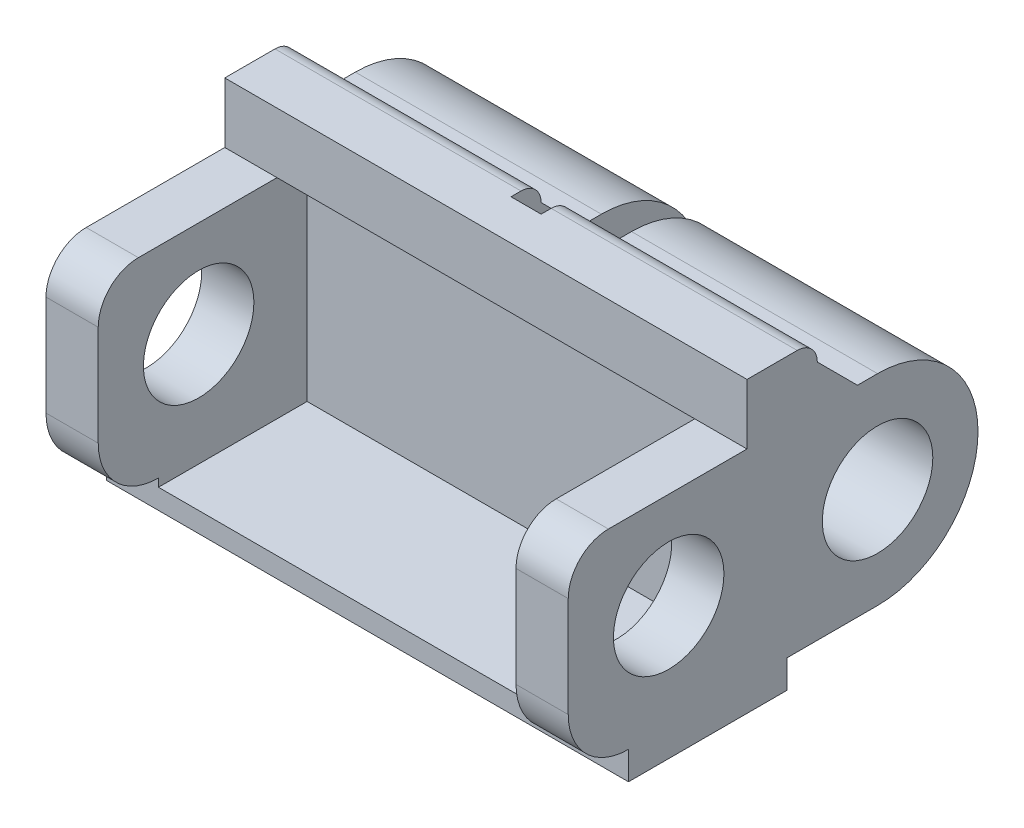
from build123d import *

# Parameters (mm, degrees)
SKETCH3_R            = 2.75
BOSS_EXTRUDE1_DEPTH  = 3
SKETCH4_R            = 2.75
BOSS_EXTRUDE2_DEPTH  = 3
BOSS_EXTRUDE3_DEPTH  = 3
BOSS_EXTRUDE4_START  = -3
SKETCH6_R            = 2.75
BOSS_EXTRUDE4_DEPTH  = 3
CUT_EXTRUDE1_START   = -0.4
CUT_EXTRUDE1_DEPTH   = 0.4
CUT_EXTRUDE2_DEPTH   = 0.4
BOSS_EXTRUDE5_DEPTH  = 26
SKETCH11_W           = 1.5
SKETCH11_H           = 10.4
CUT_EXTRUDE4_DEPTH   = 9.5
SKETCH13_W           = 13.75
SKETCH13_H           = 0.5
BOSS_EXTRUDE6_DEPTH  = 1
BOSS_EXTRUDE7_DEPTH  = 1
BOSS_EXTRUDE8_DEPTH  = 3
CHAMFER1_SIZE        = 2
FILLET1_R            = 1
SKETCH16_W           = 26
SKETCH16_H           = 3
BOSS_EXTRUDE9_DEPTH  = 1
FILLET2_R            = 2
BOSS_EXTRUDE11_DEPTH = 2.4
BOSS_EXTRUDE12_DEPTH = 1
CUT_EXTRUDE5_DEPTH   = 0.5


with BuildPart() as part:
    # Sketch3 → Boss-Extrude1 (new body)
    with BuildSketch(Plane(origin=(10, 0, 0), x_dir=(0, 0, -1), z_dir=(1, 0, 0))):
        with BuildLine():
            Line((-37, 41.45), (-42, 41.45))
            Line((-42, 41.45), (-47, 41.45))
            Line((-47, 41.45), (-47, 34.45))
            ThreePointArc((-47, 34.45), (-46.121320344, 32.328679656), (-44, 31.45))
            Line((-44, 31.45), (-40, 31.45))
            ThreePointArc((-40, 31.45), (-37.878679656, 32.328679656), (-37, 34.45))
            Line((-37, 34.45), (-37, 41.45))
        make_face()
        with Locations((-42, 36.65)):
            Circle(SKETCH3_R, mode=Mode.SUBTRACT)
    extrude(amount=BOSS_EXTRUDE1_DEPTH)

    # Sketch6 → Boss-Extrude4 (add)
    with BuildSketch(Plane(origin=(13, 0, 0), x_dir=(0, 0, -1), z_dir=(1, 0, 0)).offset(BOSS_EXTRUDE4_START)):
        with BuildLine():
            Line((-36.6, 31.45), (-36.6, 41.45))
            Line((-36.6, 41.45), (-47, 41.45))
            Line((-47, 41.45), (-47, 34.45))
            ThreePointArc((-47, 34.45), (-46.121320344, 32.328679656), (-44, 31.45))
            Line((-44, 31.45), (-36.6, 31.45))
        make_face()
        with Locations(Location((-42, 36.65, 0), (0, 0, 180))):
            Circle(SKETCH6_R, mode=Mode.SUBTRACT)
    extrude(amount=BOSS_EXTRUDE4_DEPTH)

    # Sketch8 → Cut-Extrude2 (cut)
    with BuildSketch(Plane.ZY.offset(-10)):
        with BuildLine():
            Line((47, 41.45), (36.6, 41.45))
            Line((36.6, 41.45), (36.6, 31.45))
            Line((36.6, 31.45), (44, 31.45))
            ThreePointArc((44, 31.45), (46.121320344, 32.328679656), (47, 34.45))
            Line((47, 34.45), (47, 41.45))
        make_face()
    extrude(amount=-CUT_EXTRUDE2_DEPTH, mode=Mode.SUBTRACT)



with BuildPart() as body_2:
    # Sketch4 → Boss-Extrude2 (new body)
    with BuildSketch(Plane.ZY.offset(10)):
        with BuildLine():
            Line((47, 41.45), (37, 41.45))
            Line((37, 41.45), (37, 34.45))
            ThreePointArc((37, 34.45), (37.878679656, 32.328679656), (40, 31.45))
            Line((40, 31.45), (44, 31.45))
            ThreePointArc((44, 31.45), (46.121320344, 32.328679656), (47, 34.45))
            Line((47, 34.45), (47, 41.45))
        make_face()
        with Locations((42, 36.65)):
            Circle(SKETCH4_R, mode=Mode.SUBTRACT)
    extrude(amount=BOSS_EXTRUDE2_DEPTH)

    # Sketch5 → Boss-Extrude3 (add)
    with BuildSketch(Plane.ZY.offset(13)):
        with BuildLine():
            Line((37, 41.45), (36.6, 41.45))
            Line((36.6, 41.45), (36.6, 31.45))
            Line((36.6, 31.45), (40, 31.45))
            ThreePointArc((40, 31.45), (37.878679656, 32.328679656), (37, 34.45))
            Line((37, 34.45), (37, 41.45))
        make_face()
    extrude(amount=-BOSS_EXTRUDE3_DEPTH)

    # Sketch7 → Cut-Extrude1 (cut)
    with BuildSketch(Plane(origin=(-10, 0, 0), x_dir=(0, 0, -1), z_dir=(1, 0, 0)).offset(CUT_EXTRUDE1_START)):
        with BuildLine():
            Line((-36.6, 41.45), (-47, 41.45))
            Line((-47, 41.45), (-47, 34.45))
            ThreePointArc((-47, 34.45), (-46.121320344, 32.328679656), (-44, 31.45))
            Line((-44, 31.45), (-36.6, 31.45))
            Line((-36.6, 31.45), (-36.6, 41.45))
        make_face()
    extrude(amount=CUT_EXTRUDE1_DEPTH, mode=Mode.SUBTRACT)


with BuildPart() as part_1:
    add(part.part)

    add(body_2.part)  # Boss-Extrude5 merges body 2
    # Sketch9 → Boss-Extrude5 (add)
    with BuildSketch(Plane(origin=(13, 0, 0), x_dir=(0, 0, -1), z_dir=(1, 0, 0))):
        with BuildLine():
            ThreePointArc((-31.6, 41.45), (-35.135533906, 39.985533906), (-36.6, 36.45))
            Line((-36.6, 36.45), (-34.35, 36.45))
            ThreePointArc((-34.35, 36.45), (-31.6, 39.2), (-28.85, 36.45))
            Line((-28.85, 36.45), (-26.6, 36.45))
            ThreePointArc((-26.6, 36.45), (-28.064466094, 39.985533906), (-31.6, 41.45))
        make_face()
        with BuildLine():
            Line((-34.35, 36.45), (-36.6, 36.45))
            ThreePointArc((-36.6, 36.45), (-35.135533906, 32.914466094), (-31.6, 31.45))
            ThreePointArc((-31.6, 31.45), (-28.064466094, 32.914466094), (-26.6, 36.45))
            Line((-26.6, 36.45), (-28.85, 36.45))
            ThreePointArc((-28.85, 36.45), (-31.6, 33.7), (-34.35, 36.45))
        make_face()
        with BuildLine():
            Line((-36.6, 41.45), (-36.6, 36.45))
            ThreePointArc((-36.6, 36.45), (-35.135533906, 39.985533906), (-31.6, 41.45))
            Line((-31.6, 41.45), (-36.6, 41.45))
        make_face()
        with BuildLine():
            Line((-36.6, 36.45), (-36.6, 31.45))
            Line((-36.6, 31.45), (-34.34369351, 31.45))
            Line((-34.34369351, 31.45), (-31.6, 31.45))
            ThreePointArc((-31.6, 31.45), (-35.135533906, 32.914466094), (-36.6, 36.45))
        make_face()
    extrude(amount=-BOSS_EXTRUDE5_DEPTH)

    # Sketch11 → Cut-Extrude4 (cut, symmetric)
    with BuildSketch(Plane.XY.offset(26.6)):
        with Locations((0, 36.65)):
            Rectangle(SKETCH11_W, SKETCH11_H)
    extrude(amount=CUT_EXTRUDE4_DEPTH, both=True, mode=Mode.SUBTRACT)



with BuildPart() as body_2_2:
    # Sketch13 → Boss-Extrude6 (new body)
    with BuildSketch(Plane(origin=(0, 31.05, 0), x_dir=(-1, 0, 0), z_dir=(0, -1, 0))):
        Polygon((-0.75, -36.6), (-10.4, -36.6), (-13, -36.6), (-13, -41.6), (13, -41.6), (13, -36.6), align=None)
        with Locations((6.125, -36.35)):
            Rectangle(SKETCH13_W, SKETCH13_H)
        Polygon((-13, -36.6), (-10.4, -36.6), (-0.75, -36.6), (-0.75, -36.1), (-13, -36.1), align=None)
    extrude(amount=BOSS_EXTRUDE6_DEPTH)


with BuildPart() as part_2:
    add(part_1.part)

    add(body_2_2.part)  # Boss-Extrude7 merges body 2 2
    # Sketch14 → Boss-Extrude7 (add)
    with BuildSketch(Plane.XZ.offset(-31.45)):
        Polygon((10.4, 41.6), (13, 41.6), (13, 36.1), (-13, 36.1), (-13, 41.6), (-10.4, 41.6), (-10.4, 36.6), (10.4, 36.6), align=None)
    extrude(amount=BOSS_EXTRUDE7_DEPTH)

    # Sketch15 → Boss-Extrude8 (add)
    with BuildSketch(Plane(origin=(0, 41.45, 0), x_dir=(1, 0, 0), z_dir=(0, 1, 0))):
        Polygon((-10.4, -36.6), (10.4, -36.6), (13, -36.6), (13, -34.6), (0.75, -34.6), (0.75, -36.1), (-0.75, -36.1), (-0.75, -34.6), (-13, -34.6), (-13, -36.6), align=None)
    extrude(amount=BOSS_EXTRUDE8_DEPTH)

    # Chamfer1
    chamfer1_edges = [part_2.edges().sort_by_distance(p)[0] for p in [
        (-6.875, 41.45, 34.6),
        (6.875, 41.45, 34.6),
    ]]
    chamfer(chamfer1_edges, length=CHAMFER1_SIZE)

    # Fillet1
    fillet1_edges = [part_2.edges().sort_by_distance(p)[0] for p in [
        (-6.875, 44.45, 34.6),
        (6.875, 44.45, 34.6),
    ]]
    fillet(fillet1_edges, radius=FILLET1_R - 0.0001)  # a hair under: the kernel refuses the full size

    # Sketch16 → Boss-Extrude9 (add)
    with BuildSketch(Plane.XY.offset(36.6)):
        with Locations((0, 42.95)):
            Rectangle(SKETCH16_W, SKETCH16_H)
    extrude(amount=BOSS_EXTRUDE9_DEPTH)

    # Fillet2
    fillet2_edges = [part_2.edges().sort_by_distance(p)[0] for p in [
        (-11.7, 41.45, 47),
        (11.7, 41.45, 47),
    ]]
    fillet(fillet2_edges, radius=FILLET2_R)

    # Sketch17 → Boss-Extrude11 (add)
    with BuildSketch(Plane.XY.offset(41.6)):
        Polygon((10.4, 31.05), (-10.4, 31.05), (-10.4, 31.45), (-13, 31.45), (-13, 30.05), (13, 30.05), (13, 31.45), (10.4, 31.45), align=None)
    extrude(amount=BOSS_EXTRUDE11_DEPTH)

    # Sketch18 → Boss-Extrude12 (add)
    with BuildSketch(Plane.XY.offset(37.6)):
        Polygon((-13, 44.45), (-13, 41.45), (-10.4, 41.45), (10.4, 41.45), (13, 41.45), (13, 44.45), align=None)
    extrude(amount=BOSS_EXTRUDE12_DEPTH)

    # Sketch19 → Cut-Extrude5 (cut)
    with BuildSketch(Plane.XY.offset(38.6)):
        Polygon((13, 44.45), (-13, 44.45), (-13, 41.45), (-10.4, 41.45), (10.4, 41.45), (13, 41.45), align=None)
    extrude(amount=-CUT_EXTRUDE5_DEPTH, mode=Mode.SUBTRACT)


solid = part_2.part
